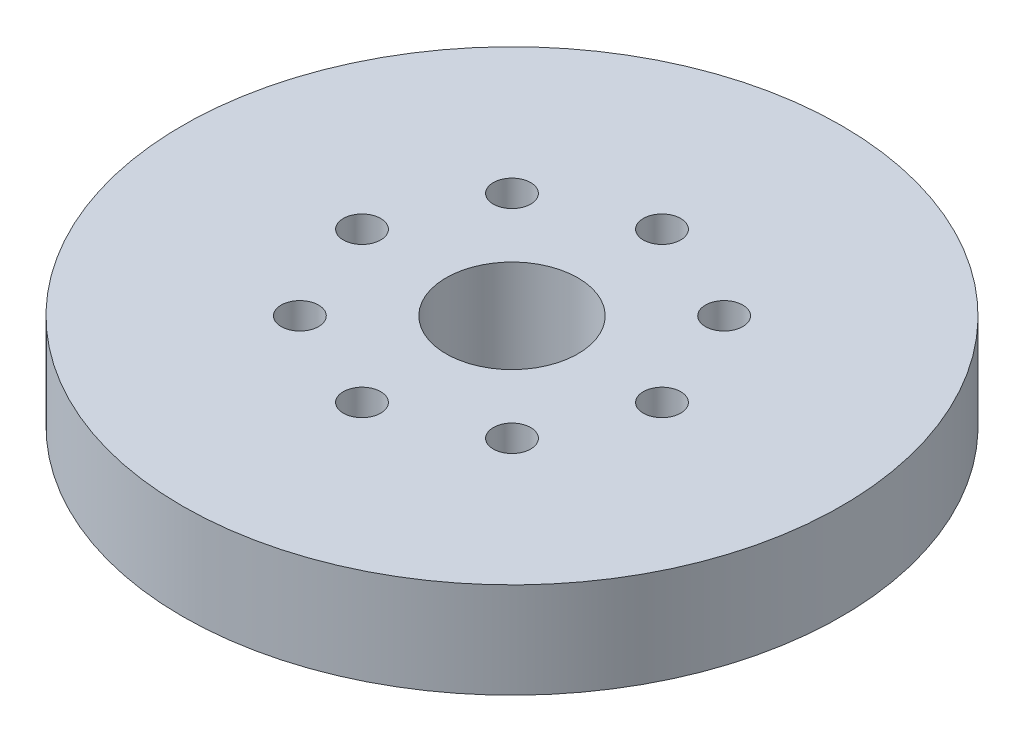
from build123d import *

# Parameters (mm, degrees)
SKETCH1_R           = 100
BOSS_EXTRUDE1_DEPTH = 29
SKETCH2_R           = 20
CUT_EXTRUDE1_DEPTH  = 145.364122967
SKETCH3_R           = 5.671555205
CUT_EXTRUDE2_DEPTH  = 26.018232772
CIRPATTERN1_COUNT   = 8


with BuildPart() as part:
    # Sketch1 → Boss-Extrude1 (new body)
    with BuildSketch(Plane(origin=(0, 0, 0), x_dir=(1, 0, 0), z_dir=(0, 1, 0))):
        Circle(SKETCH1_R)
    extrude(amount=BOSS_EXTRUDE1_DEPTH)

    # Sketch2 → Cut-Extrude1 (cut, through all)
    with BuildSketch(Plane(origin=(0, 0, 0), x_dir=(1, 0, 0), z_dir=(0, 1, 0))):
        Circle(SKETCH2_R)
    extrude(amount=CUT_EXTRUDE1_DEPTH, mode=Mode.SUBTRACT)

    # Sketch3 → Cut-Extrude2 (cut)
    with BuildSketch(Plane(origin=(0, 29, 0), x_dir=(1, 0, 0), z_dir=(0, 1, 0))):
        with Locations((-45.514579241, 0)):
            Circle(SKETCH3_R)
    cut_extrude2 = extrude(amount=-CUT_EXTRUDE2_DEPTH, mode=Mode.SUBTRACT)

    # CirPattern1: Cut-Extrude2 ×8 about axis
    cirpattern1_axis = Axis((0, 0, 0), (0, 1, 0))
    for i in range(1, CIRPATTERN1_COUNT):
        add(cut_extrude2.rotate(cirpattern1_axis, i * 360 / CIRPATTERN1_COUNT), mode=Mode.SUBTRACT)


solid = part.part
